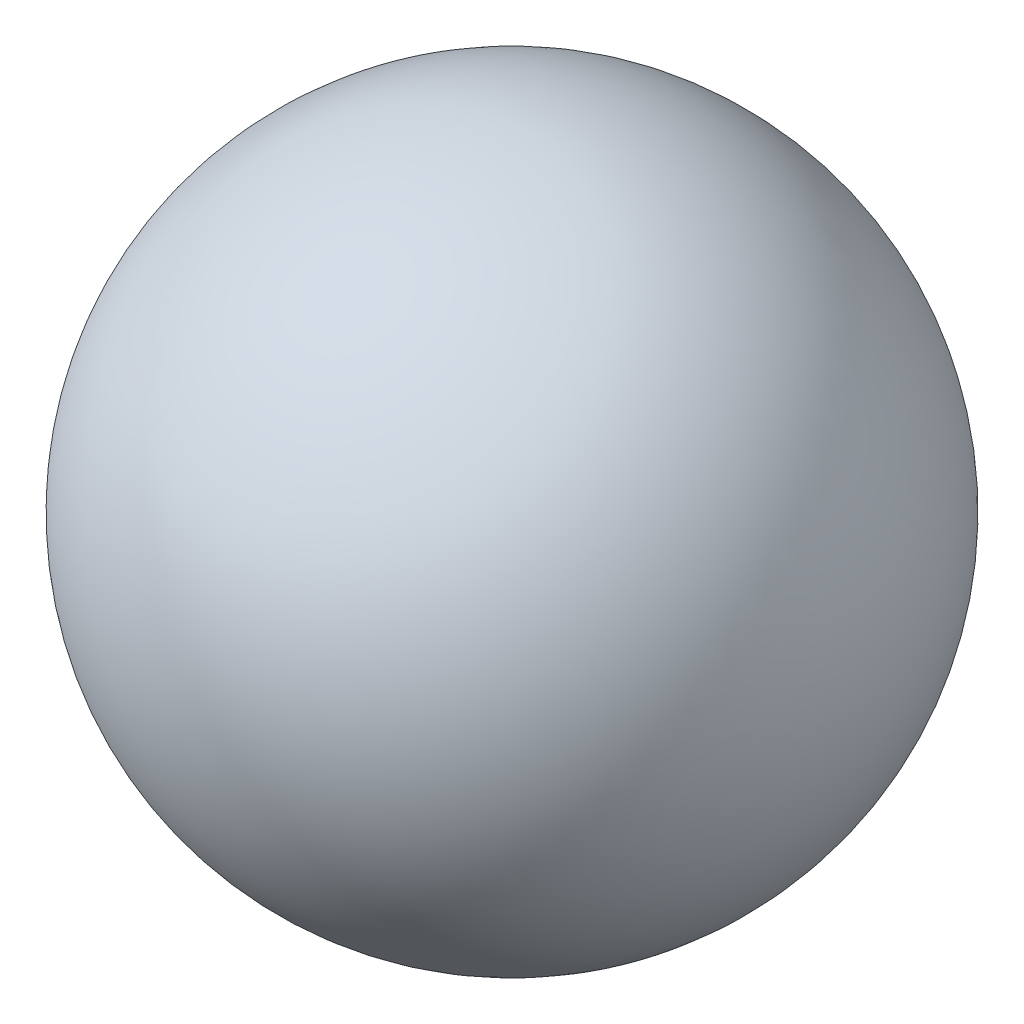
from build123d import *


with BuildPart() as part:
    # 草图1 → 旋转4 (revolve)
    with BuildSketch(Plane.XY):
        with BuildLine():
            Line((8.045503293, -23.670020633), (0, 0))
            Line((0, 0), (-8.045503293, 23.670020633))
            ThreePointArc((-8.045503293, 23.670020633), (-23.670020633, -8.045503293), (8.045503293, -23.670020633))
        make_face()
    revolve(axis=Axis((-10.010623271, 29.451440231, 0), (0.32182013173295365, -0.9468008253119472, 0)))


solid = part.part
